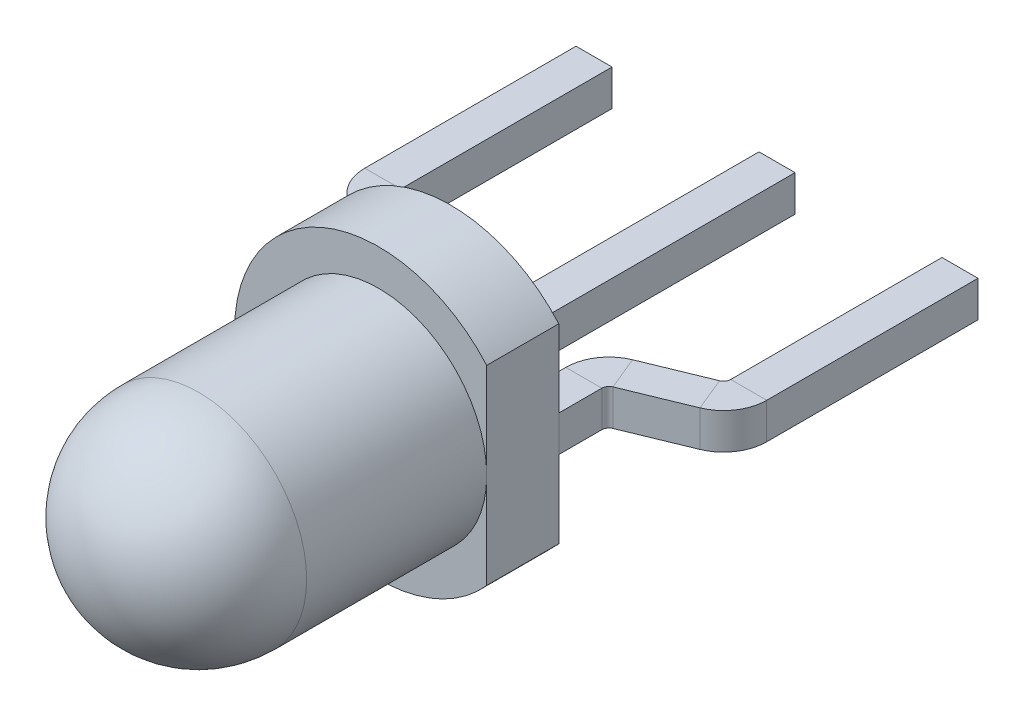
from build123d import *

# Parameters (mm, degrees)
SKETCH1_R           = 2
BOSS_EXTRUDE1_DEPTH = 1
SKETCH2_R           = 1.5
BOSS_EXTRUDE2_DEPTH = 2.5
DOME1_FACE_RADIUS   = 1.5
DOME1_HEIGHT        = 1.5
CUT_EXTRUDE1_REACH  = 6.899
SKETCH3_W           = 0.5
SKETCH3_H           = 4.031292186
SKETCH8_W           = 0.5
SKETCH8_H           = 4.53
BASE_FLANGE1_DEPTH  = 0.25
BASE_FLANGE2_DEPTH  = 0.25
BASE_FLANGE3_DEPTH  = 0.25


# Sheet-metal steps are written as plain solids
with BuildPart() as part:
    # Sketch1 → Boss-Extrude1 (new body)
    with BuildSketch(Plane.XY):
        Circle(SKETCH1_R)
    extrude(amount=BOSS_EXTRUDE1_DEPTH)

    # Sketch2 → Boss-Extrude2 (add)
    with BuildSketch(Plane.XY.offset(1)):
        Circle(SKETCH2_R)
    extrude(amount=BOSS_EXTRUDE2_DEPTH)

    # Dome1: a dome of height H over a round flat face of radius A is a cap of a sphere of radius (A * A + H * H) / (2 * H)
    dome1_r = (DOME1_FACE_RADIUS * DOME1_FACE_RADIUS + DOME1_HEIGHT * DOME1_HEIGHT) / (2 * DOME1_HEIGHT)
    dome1_base = Plane((0, 0, 3.5), z_dir=(0, 0, 1))
    with Locations(dome1_base.offset(DOME1_HEIGHT - dome1_r)):
        dome1_ball = Sphere(dome1_r, mode=Mode.PRIVATE)
    add(split(dome1_ball, bisect_by=dome1_base, keep=Keep.TOP, mode=Mode.PRIVATE))

    # Sketch3 → Cut-Extrude1 (cut, up to next)
    with BuildSketch(Plane.XY.offset(1), mode=Mode.PRIVATE) as cut_extrude1_sk1:
        with Locations((1.75, -0.165370345)):
            Rectangle(SKETCH3_W, SKETCH3_H)
    cut_extrude1_tool1 = extrude(cut_extrude1_sk1.sketch, amount=-CUT_EXTRUDE1_REACH, mode=Mode.PRIVATE) & part.part
    add(cut_extrude1_tool1.solids().sort_by_distance((1.75, -0.16537, 1))[0], mode=Mode.SUBTRACT)


with BuildPart() as body_2:
    # Sketch8 → Base-Flange1 (new, symmetric)
    with BuildSketch(Plane(origin=(0, 0, 0), x_dir=(1, 0, 0), z_dir=(0, 1, 0))):
        with Locations((0, 2.265)):
            Rectangle(SKETCH8_W, SKETCH8_H)
    extrude(amount=BASE_FLANGE1_DEPTH, both=True)


with BuildPart() as body_3:
    # Sketch11 → Base-Flange2 (new, symmetric)
    with BuildSketch(Plane(origin=(0, 0, 0), x_dir=(1, 0, 0), z_dir=(0, 1, 0))):
        with BuildLine():
            Line((1, 0), (1, 0.597845317))
            ThreePointArc((1, 0.597845317), (1.101597438, 0.931903524), (1.371982953, 1.152830205))
            Line((1.371982953, 1.152830205), (2.228002841, 1.504528299))
            ThreePointArc((2.228002841, 1.504528299), (2.273067094, 1.541349413), (2.29, 1.59702578))
            Line((2.29, 1.59702578), (2.29, 4.53))
            Line((2.29, 4.53), (2.79, 4.53))
            Line((2.79, 4.53), (2.79, 1.59702578))
            ThreePointArc((2.79, 1.59702578), (2.688402562, 1.262967573), (2.418017047, 1.042040892))
            Line((2.418017047, 1.042040892), (1.561997159, 0.690342799))
            ThreePointArc((1.561997159, 0.690342799), (1.516932906, 0.653521685), (1.5, 0.597845317))
            Line((1.5, 0.597845317), (1.5, 0))
            Line((1.5, 0), (1, 0))
        make_face()
    extrude(amount=BASE_FLANGE2_DEPTH, both=True)


with BuildPart() as body_4:
    # Sketch14 → Base-Flange3 (new, symmetric)
    with BuildSketch(Plane(origin=(0, 0, 0), x_dir=(1, 0, 0), z_dir=(0, 1, 0))):
        with BuildLine():
            Line((-1, 0), (-1, 0.597845317))
            ThreePointArc((-1, 0.597845317), (-1.101597438, 0.931903524), (-1.371982953, 1.152830205))
            Line((-1.371982953, 1.152830205), (-2.228002841, 1.504528299))
            ThreePointArc((-2.228002841, 1.504528299), (-2.273067094, 1.541349413), (-2.29, 1.59702578))
            Line((-2.29, 1.59702578), (-2.29, 4.53))
            Line((-2.29, 4.53), (-2.79, 4.53))
            Line((-2.79, 4.53), (-2.79, 1.59702578))
            ThreePointArc((-2.79, 1.59702578), (-2.688402562, 1.262967573), (-2.418017047, 1.042040892))
            Line((-2.418017047, 1.042040892), (-1.561997159, 0.690342799))
            ThreePointArc((-1.561997159, 0.690342799), (-1.516932906, 0.653521685), (-1.5, 0.597845317))
            Line((-1.5, 0.597845317), (-1.5, 0))
            Line((-1.5, 0), (-1, 0))
        make_face()
    extrude(amount=BASE_FLANGE3_DEPTH, both=True)


solid = Compound([part.part, body_2.part, body_3.part, body_4.part])
